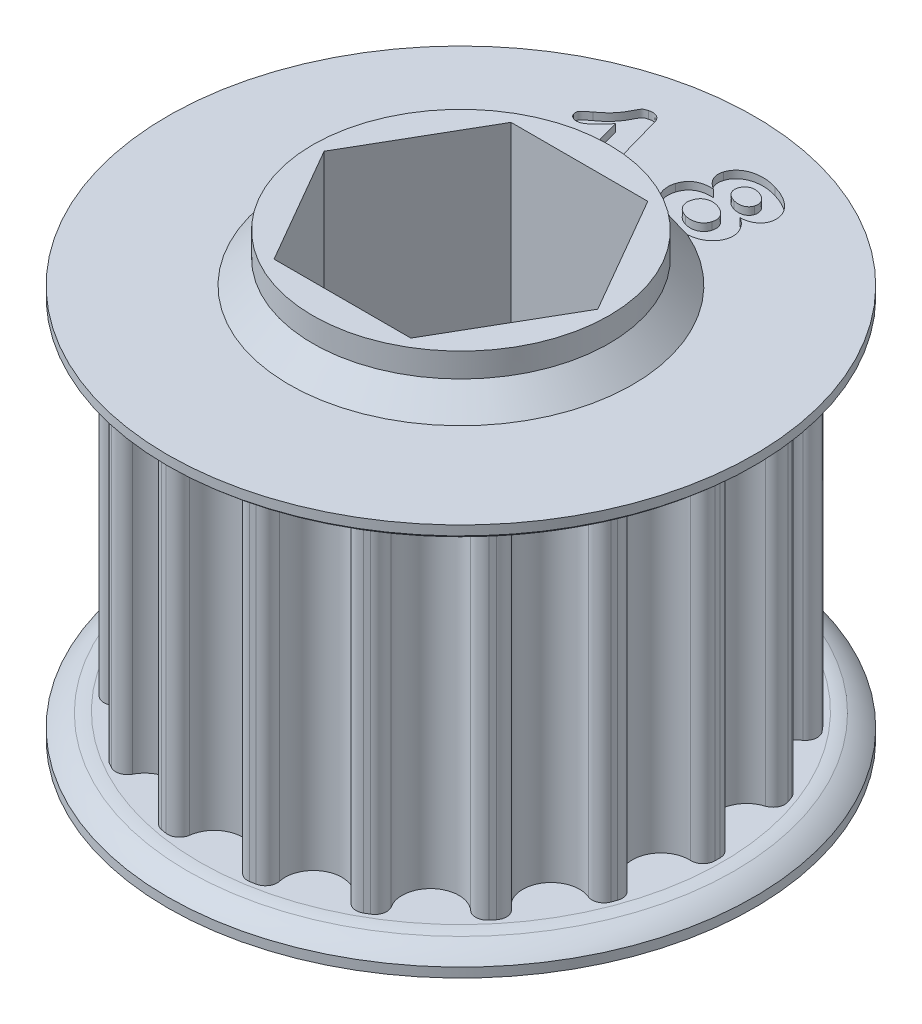
from build123d import *

# Parameters (mm, degrees)
SKETCH1_R               = 13.752444609
TOOTHOD_DEPTH           = 9.2456
TOOTHPROFILE_DEPTH      = 27.836243084
TOOTHPATTERN_COUNT      = 18
BORE_DEPTH              = 25.594187162
BORE_DEPTH_BACK         = 25.594187162
LARGE_TOOTH_COUNT_DEPTH = 0.4
SKETCH11_R              = 11.1125
CUT_EXTRUDE1_DEPTH      = 2.0574
SKETCH12_R              = 7.9375
BOSS_EXTRUDE1_DEPTH     = 2.5654
CHAMFER1_START          = 10.5156
CHAMFER1_2_DEPTH        = 1.4844


with BuildPart() as part:
    # Sketch1 → ToothOD (new, symmetric)
    with BuildSketch(Plane(origin=(0, 0, 0), x_dir=(1, 0, 0), z_dir=(0, 1, 0))):
        with Locations(Location((0, 0, 0), (0, 0, 270))):
            Circle(SKETCH1_R)
    extrude(amount=TOOTHOD_DEPTH, both=True)

    # Sketch2 → ToothProfile (cut, through all)
    with BuildSketch(Plane(origin=(0, 9.2456, 0), x_dir=(1, 0, 0), z_dir=(0, 1, 0))):
        with BuildLine():
            ThreePointArc((-1.512488775, 13.022501785), (0, 11.692444609), (1.512488775, 13.022501785))
            ThreePointArc((1.512488775, 13.022501785), (1.763425847, 13.450931805), (2.245984388, 13.567803317))
            ThreePointArc((2.245984388, 13.567803317), (0, 13.752444609), (-2.245984388, 13.567803317))
            ThreePointArc((-2.245984388, 13.567803317), (-1.763425847, 13.450931805), (-1.512488775, 13.022501785))
        make_face()
    toothprofile = extrude(amount=-TOOTHPROFILE_DEPTH, mode=Mode.SUBTRACT)

    # ToothPattern: ToothProfile ×18 about axis
    toothpattern_axis = Axis((0, 0, 0), (0, 1, 0))
    for i in range(1, TOOTHPATTERN_COUNT):
        add(toothprofile.rotate(toothpattern_axis, i * 360 / TOOTHPATTERN_COUNT), mode=Mode.SUBTRACT)

    # Sketch4 → Flange (revolve)
    with BuildSketch(Plane.XY, mode=Mode.PRIVATE) as flange_sk:
        with BuildLine():
            Line((0, -9.2456), (14.006444609, -9.2456))
            ThreePointArc((14.006444609, -9.2456), (14.332200599, -9.271222571), (14.652016937, -9.338237424))
            ThreePointArc((14.652016937, -9.338237424), (15.219745514, -9.619797125), (15.720944609, -10.0076))
            Line((15.720944609, -10.0076), (15.720944609, -10.5156))
            Line((15.720944609, -10.5156), (0, -10.5156))
            Line((0, -10.5156), (0, -9.2456))
        make_face()
        with BuildLine():
            Line((15.720944609, 10.5156), (15.720944609, 10.0076))
            ThreePointArc((15.720944609, 10.0076), (15.219745514, 9.619797125), (14.652016937, 9.338237424))
            ThreePointArc((14.652016937, 9.338237424), (14.332200599, 9.271222571), (14.006444609, 9.2456))
            Line((14.006444609, 9.2456), (0, 9.2456))
            Line((0, 9.2456), (0, 10.5156))
            Line((0, 10.5156), (15.720944609, 10.5156))
        make_face()
    revolve(flange_sk.sketch.rotate(Axis((0, 12.09802, 0), (0, -1, 0)), 90), axis=Axis((0, 12.09802, 0), (0, -1, 0)))

    # Sketch7 → Bore (cut, two sides: drawn at the far end of the back side and taken through both)
    with BuildSketch(Plane.XZ.offset(-BORE_DEPTH_BACK)):
        Polygon((3.666174209, -6.35), (7.332348419, 0), (3.666174209, 6.35), (-3.666174209, 6.35), (-7.332348419, 0), (-3.666174209, -6.35), align=None)
    extrude(amount=BORE_DEPTH + BORE_DEPTH_BACK, mode=Mode.SUBTRACT)

    # Sketch9 → Large Tooth Count (cut)
    # profile 1 of 2: a face of its own
    with BuildSketch(Plane(origin=(0, 10.5156, 0), x_dir=(1, 0, 0), z_dir=(0, 1, 0))):
        with BuildLine():
            Line((-2.662146112, 9.13643455), (-3.372949237, 11.650141581))
            add(Edge.make_bspline(
                [(-3.372949237, 11.650141581), (-3.425886305, 11.586746329), (-3.526926809, 11.465744383), (-3.67664036, 11.297436133), (-3.817791006, 11.151368133), (-3.949782561, 11.026746314), (-4.072552361, 10.923123379), (-4.1869291, 10.842020082), (-4.292131744, 10.781515123), (-4.362268826, 10.75688488), (-4.394505487, 10.745564238)],
                knots=[0, 0, 0, 0, 1.436647793, 2.742116684, 3.917528266, 4.968830495, 5.898952687, 6.709145598, 7.406692804, 8, 8, 8, 8], degree=3))
            add(Edge.make_bspline(
                [(-4.394505487, 10.745564238), (-4.423225201, 10.738815168), (-4.479844536, 10.725509748), (-4.567027042, 10.724682351), (-4.653271396, 10.736776751), (-4.735603427, 10.765339726), (-4.810361493, 10.805553804), (-4.872610741, 10.856712818), (-4.919809372, 10.919411507), (-4.93684367, 10.967618861), (-4.945467205, 10.992023613)],
                knots=[0, 0, 0, 0, 1.060506449, 2.090730045, 3.121009508, 4.186389385, 5.213927772, 6.165926039, 7.071508468, 8, 8, 8, 8], degree=3))
            add(Edge.make_bspline(
                [(-4.945467205, 10.992023613), (-4.952065941, 11.020431127), (-4.964499631, 11.073958086), (-4.95876176, 11.154221258), (-4.933697382, 11.226612115), (-4.883870287, 11.29032499), (-4.815598949, 11.352245055), (-4.731276461, 11.425268944), (-4.627016749, 11.507793149), (-4.54950049, 11.564404933), (-4.507912518, 11.594777519)],
                knots=[0, 0, 0, 0, 0.867897154, 1.635338254, 2.373085074, 3.124455607, 4.024800266, 5.129413542, 6.459911912, 8, 8, 8, 8], degree=3))
            add(Edge.make_bspline(
                [(-4.507912518, 11.594777519), (-4.44609749, 11.640572606), (-4.328078056, 11.728006203), (-4.167080305, 11.863045983), (-4.028489817, 11.99292925), (-3.912000809, 12.121676072), (-3.810672556, 12.249752549), (-3.718419857, 12.37979078), (-3.632959576, 12.513484127), (-3.570696337, 12.628710391), (-3.523124928, 12.71775882), (-3.491102822, 12.778706459), (-3.461657521, 12.833195777), (-3.434800545, 12.881377655), (-3.411198733, 12.923363496), (-3.389042374, 12.95817431), (-3.371822103, 12.987621058), (-3.350916395, 13.01936294), (-3.316732198, 13.053885704), (-3.260586928, 13.088060996), (-3.187083714, 13.118654111), (-3.131728276, 13.135673378), (-3.101486737, 13.144971269)],
                knots=[0, 0, 0, 0, 2.156763678, 4.117769312, 5.888962717, 7.478421277, 8.981374143, 10.465881738, 11.947829572, 13.427330936, 14.136785022, 14.77897899, 15.35784481, 15.873440825, 16.325849854, 16.708062088, 17.030133901, 17.282469466, 17.772361054, 18.376662839, 19.11314557, 20, 20, 20, 20], degree=3))
            add(Edge.make_bspline(
                [(-3.101486737, 13.144971269), (-3.059460626, 13.15491324), (-2.979408203, 13.173850962), (-2.860298498, 13.180591748), (-2.750571479, 13.162194548), (-2.65157859, 13.123624115), (-2.56509284, 13.067261641), (-2.494384027, 12.994951844), (-2.437531316, 12.909631659), (-2.416002124, 12.844415872), (-2.404971112, 12.811000956)],
                knots=[0, 0, 0, 0, 1.193490103, 2.273390807, 3.275207668, 4.247795912, 5.193374318, 6.107594792, 7.030379579, 8, 8, 8, 8], degree=3))
            Line((-2.404971112, 12.811000956), (-1.493250018, 9.582918925))
            add(Edge.make_bspline(
                [(-1.493250018, 9.582918925), (-1.486605218, 9.557707275), (-1.473647205, 9.508542073), (-1.46130282, 9.435343256), (-1.454795986, 9.365777239), (-1.454643505, 9.299694786), (-1.460757228, 9.237131037), (-1.473192451, 9.177772287), (-1.492077421, 9.122024156), (-1.517042142, 9.069486256), (-1.549717514, 9.021451015), (-1.5877077, 8.97596986), (-1.632174898, 8.934000332), (-1.683937705, 8.896987485), (-1.740170049, 8.861156874), (-1.804335751, 8.83170957), (-1.873830288, 8.803473188), (-1.923220153, 8.788662787), (-1.94866408, 8.781032988)],
                knots=[0, 0, 0, 0, 1.181889984, 2.304801904, 3.361933679, 4.347340366, 5.296963687, 6.207702345, 7.091327474, 7.960712225, 8.836778226, 9.718235453, 10.644546812, 11.600290629, 12.600472129, 13.663105359, 14.796113795, 16, 16, 16, 16], degree=3))
            add(Edge.make_bspline(
                [(-1.94866408, 8.781032988), (-1.989211377, 8.771066321), (-2.067454662, 8.751833847), (-2.184756361, 8.745559899), (-2.294958548, 8.758710424), (-2.396958286, 8.791433537), (-2.488622267, 8.845470542), (-2.563995893, 8.923269444), (-2.624470609, 9.021415317), (-2.649149437, 9.096757108), (-2.662146112, 9.13643455)],
                knots=[0, 0, 0, 0, 1.107720024, 2.137544594, 3.102013595, 4.042570764, 4.965058633, 5.899173896, 6.893636507, 8, 8, 8, 8], degree=3))
        make_face()
    # profile 2 of 2: a face of its own
    with BuildSketch(Plane(origin=(0, 10.5156, 0), x_dir=(1, 0, 0), z_dir=(0, 1, 0))):
        with BuildLine():
            add(Edge.make_bspline(
                [(1.763977795, 12.304863932), (1.772462452, 12.330925447), (1.789409695, 12.382980691), (1.822746894, 12.457928668), (1.861996616, 12.529759128), (1.908208107, 12.597569456), (1.958768894, 12.663566132), (2.017539963, 12.724633224), (2.080771418, 12.784058906), (2.150427719, 12.839206694), (2.22569855, 12.890125876), (2.30568538, 12.936665148), (2.391013515, 12.97679765), (2.480719945, 13.011333606), (2.574598516, 13.04245408), (2.674015418, 13.065601087), (2.777807679, 13.086042439), (2.886490092, 13.098685433), (2.998509103, 13.10701498), (3.113291996, 13.108640429), (3.230136487, 13.104183693), (3.349320245, 13.093224852), (3.471023459, 13.076557195), (3.594999628, 13.051642422), (3.721847829, 13.022871641), (3.806306036, 12.99852411), (3.849059827, 12.986199088)],
                knots=[0, 0, 0, 0, 0.809842585, 1.617578695, 2.421037097, 3.226468951, 4.041506402, 4.875701726, 5.728760898, 6.605590954, 7.498914008, 8.413610117, 9.338661129, 10.283221307, 11.254460088, 12.259746471, 13.298747387, 14.380436365, 15.492066129, 16.618608475, 17.772252836, 18.947412154, 20.155840334, 21.401908303, 22.684813797, 24, 24, 24, 24], degree=3))
            add(Edge.make_bspline(
                [(3.849059827, 12.986199088), (3.921744044, 12.963393107), (4.063013946, 12.919067133), (4.263615875, 12.837615732), (4.448791288, 12.750080082), (4.617334336, 12.653367133), (4.76893637, 12.549885927), (4.904788282, 12.441876541), (5.023311509, 12.328614307), (5.123331996, 12.210404574), (5.207100474, 12.090647296), (5.273414118, 11.969923529), (5.323714505, 11.849412293), (5.355584669, 11.729149315), (5.373336155, 11.610429497), (5.374356023, 11.493524455), (5.364108658, 11.377974964), (5.344103101, 11.303635405), (5.334066858, 11.266341275)],
                knots=[0, 0, 0, 0, 1.450841889, 2.819873404, 4.121144449, 5.350717867, 6.517866185, 7.615223588, 8.654029127, 9.635771325, 10.560789381, 11.433865107, 12.255316122, 13.042192494, 13.798494955, 14.535827359, 15.265464505, 16, 16, 16, 16], degree=3))
            add(Edge.make_bspline(
                [(5.334066858, 11.266341275), (5.326201711, 11.24264209), (5.310694583, 11.195916162), (5.279369686, 11.129357787), (5.244159994, 11.06525157), (5.200752722, 11.005754744), (5.152449253, 10.949254663), (5.098545619, 10.89616432), (5.038392116, 10.846981853), (4.972571667, 10.801770681), (4.902351186, 10.761047185), (4.828942803, 10.724755402), (4.751878536, 10.695703264), (4.671981479, 10.671299723), (4.588679913, 10.652696759), (4.501917399, 10.63911048), (4.411750034, 10.63212375), (4.350621136, 10.631670236), (4.319654358, 10.631440494)],
                knots=[0, 0, 0, 0, 0.931638965, 1.836843536, 2.742662106, 3.658788272, 4.581097284, 5.516442172, 6.47996071, 7.478923982, 8.495054935, 9.509177662, 10.53306083, 11.566851322, 12.626608633, 13.717616295, 14.843786302, 16, 16, 16, 16], degree=3))
            add(Edge.make_bspline(
                [(4.319654358, 10.631440494), (4.361307268, 10.607327044), (4.444162199, 10.55936117), (4.558151982, 10.471594464), (4.662158905, 10.372046293), (4.754808795, 10.261971912), (4.835689529, 10.146246348), (4.901665885, 10.027356768), (4.950049599, 9.906575805), (4.983939916, 9.785368394), (5.000677763, 9.663427342), (5.002752128, 9.541049264), (4.988521314, 9.418571782), (4.967707685, 9.338520706), (4.957234045, 9.29823815)],
                knots=[0, 0, 0, 0, 1.083019542, 2.154315536, 3.230612772, 4.31985941, 5.389139951, 6.406207581, 7.374704119, 8.313081631, 9.233642139, 10.138744009, 11.063396134, 12, 12, 12, 12], degree=3))
            add(Edge.make_bspline(
                [(4.957234045, 9.29823815), (4.947674325, 9.268560251), (4.92871191, 9.209691938), (4.890448615, 9.125339883), (4.846004466, 9.044946648), (4.794242084, 8.96871785), (4.73763191, 8.894758296), (4.671663536, 8.826503057), (4.600442935, 8.7610181), (4.522343457, 8.700368538), (4.43864025, 8.643791827), (4.347987216, 8.593898738), (4.251695944, 8.549878928), (4.149020754, 8.514108883), (4.041900259, 8.480948977), (3.92825936, 8.456680054), (3.809034602, 8.437722832), (3.684393539, 8.425699685), (3.555339168, 8.418765088), (3.422741585, 8.421804227), (3.287038426, 8.427793631), (3.148345683, 8.444146966), (3.006268368, 8.464618397), (2.861651006, 8.495513222), (2.713072127, 8.529024958), (2.614234053, 8.558294458), (2.564077795, 8.573147525)],
                knots=[0, 0, 0, 0, 0.806619525, 1.599989631, 2.393359737, 3.182000434, 3.983561344, 4.801185139, 5.63573712, 6.48663646, 7.358628842, 8.248550908, 9.162438473, 10.095996992, 11.061419444, 12.063570583, 13.101151084, 14.185356624, 15.304012189, 16.444588286, 17.617504992, 18.819080606, 20.058196613, 21.332188171, 22.646195229, 24, 24, 24, 24], degree=3))
            add(Edge.make_bspline(
                [(2.564077795, 8.573147525), (2.513976768, 8.588928347), (2.415652908, 8.619898398), (2.272336293, 8.67053232), (2.136630933, 8.726046176), (2.007660128, 8.78509497), (1.885386852, 8.847434304), (1.769670991, 8.913305486), (1.661969522, 8.984129873), (1.560547725, 9.057222684), (1.467176413, 9.133546561), (1.382078774, 9.212751463), (1.303819594, 9.292880016), (1.234198893, 9.376031679), (1.172223251, 9.461405414), (1.117414356, 9.548437429), (1.072068569, 9.638492656), (1.033177853, 9.729558234), (1.003095849, 9.822270329), (0.980441119, 9.915395631), (0.966428834, 10.008939556), (0.958605911, 10.102663897), (0.961001664, 10.196788578), (0.970023992, 10.290747037), (0.985476495, 10.385415073), (1.003139692, 10.447337191), (1.012098108, 10.478742838)],
                knots=[0, 0, 0, 0, 1.376526694, 2.701449926, 3.981976521, 5.217619407, 6.417713473, 7.577794816, 8.705021807, 9.794114075, 10.852836068, 11.862969898, 12.839410823, 13.786238464, 14.702130897, 15.602579528, 16.478224059, 17.341692661, 18.195202806, 19.029570204, 19.85037214, 20.671803966, 21.491010489, 22.313774607, 23.144780554, 24, 24, 24, 24], degree=3))
            add(Edge.make_bspline(
                [(1.012098108, 10.478742838), (1.022489656, 10.511418084), (1.042945662, 10.575740074), (1.083695201, 10.666471649), (1.129238187, 10.751224368), (1.180965517, 10.829207504), (1.239543931, 10.900183035), (1.303751181, 10.964591049), (1.374523034, 11.022337834), (1.450663231, 11.074151633), (1.533929475, 11.117933871), (1.622650887, 11.155546141), (1.717680474, 11.186667035), (1.818793017, 11.211789223), (1.926295132, 11.229522339), (2.039993197, 11.239772765), (2.159538658, 11.24444972), (2.241120558, 11.24239017), (2.282792639, 11.24133815)],
                knots=[0, 0, 0, 0, 1.017533359, 2.003038312, 2.948397344, 3.872691892, 4.777030521, 5.677125236, 6.569022037, 7.485974566, 8.407390212, 9.358024634, 10.344797424, 11.373899457, 12.449303277, 13.57695381, 14.762306631, 16, 16, 16, 16], degree=3))
            add(Edge.make_bspline(
                [(2.282792639, 11.24133815), (2.254274958, 11.260045555), (2.198919131, 11.296358599), (2.121575845, 11.35540382), (2.050379159, 11.414369472), (1.986360376, 11.475406995), (1.930181732, 11.538227404), (1.879911957, 11.601423332), (1.836442892, 11.666002447), (1.801066438, 11.732423119), (1.770807428, 11.799166743), (1.749696582, 11.868010708), (1.733987105, 11.937826467), (1.726550615, 12.009086791), (1.724021452, 12.081750089), (1.731078191, 12.155210386), (1.743148857, 12.23033384), (1.756937838, 12.279673561), (1.763977795, 12.304863932)],
                knots=[0, 0, 0, 0, 1.274930318, 2.474774172, 3.636214709, 4.730432849, 5.778623564, 6.785091583, 7.748223775, 8.684484688, 9.596482191, 10.483552873, 11.372088692, 12.268121665, 13.158815903, 14.085902129, 15.02275827, 16, 16, 16, 16], degree=3))
        make_face()
        with BuildLine():
            add(Edge.make_bspline(
                [(3.765120764, 9.687572525), (3.773524693, 9.719532551), (3.78999335, 9.782162628), (3.797931704, 9.877753636), (3.791038231, 9.971015501), (3.768020698, 10.060918977), (3.732102503, 10.147352136), (3.682450847, 10.229219188), (3.619122936, 10.305717577), (3.542823817, 10.375674528), (3.456251094, 10.440094267), (3.359480351, 10.49629786), (3.25326934, 10.543769564), (3.178380481, 10.568681223), (3.140042639, 10.581434244)],
                knots=[0, 0, 0, 0, 0.970304789, 1.901446026, 2.805705687, 3.70792968, 4.618226953, 5.548915551, 6.512724104, 7.528432887, 8.585791224, 9.680178579, 10.812414185, 12, 12, 12, 12], degree=3))
            add(Edge.make_bspline(
                [(3.140042639, 10.581434244), (3.09092203, 10.594017005), (2.995769295, 10.618391378), (2.850797443, 10.628269433), (2.71113197, 10.614265573), (2.599906196, 10.58195036), (2.516345937, 10.54472983), (2.458996499, 10.508199256), (2.405321441, 10.466361037), (2.358347345, 10.415772933), (2.315626593, 10.358702426), (2.278619052, 10.294406461), (2.245906021, 10.22336671), (2.229579119, 10.172653783), (2.221177795, 10.146558463)],
                knots=[0, 0, 0, 0, 1.588024391, 3.076200886, 4.531169983, 5.970232692, 6.6889002, 7.393602153, 8.097932852, 8.817873035, 9.551785792, 10.330091813, 11.140716344, 12, 12, 12, 12], degree=3))
            add(Edge.make_bspline(
                [(2.221177795, 10.146558463), (2.211734457, 10.111949786), (2.19338643, 10.044706523), (2.184917495, 9.942731706), (2.190664018, 9.845088621), (2.212481193, 9.752322449), (2.247755792, 9.665985126), (2.292751134, 9.58536144), (2.348438683, 9.511518257), (2.415218514, 9.445697436), (2.490149842, 9.385994473), (2.574895145, 9.337089622), (2.665697052, 9.292664744), (2.730750329, 9.27155587), (2.764102795, 9.260733463)],
                knots=[0, 0, 0, 0, 1.10409687, 2.145215691, 3.138473457, 4.109085983, 5.068570516, 6.005447555, 6.94890931, 7.909358987, 8.88977135, 9.89395062, 10.920239789, 12, 12, 12, 12], degree=3))
            add(Edge.make_bspline(
                [(2.764102795, 9.260733463), (2.802018995, 9.250350093), (2.87622771, 9.230027999), (2.988341317, 9.214665402), (3.09731007, 9.209097426), (3.202514153, 9.218526967), (3.302809386, 9.238552504), (3.396154575, 9.27085605), (3.482313393, 9.314056988), (3.559856224, 9.368552315), (3.628953626, 9.433240929), (3.685847588, 9.509190592), (3.733740243, 9.59382234), (3.754515905, 9.65589021), (3.765120764, 9.687572525)],
                knots=[0, 0, 0, 0, 1.160276165, 2.270865915, 3.335849153, 4.377261886, 5.382744493, 6.350565096, 7.286579906, 8.220982215, 9.141627236, 10.070301291, 11.014992418, 12, 12, 12, 12], degree=3))
        make_face(mode=Mode.SUBTRACT)
        with BuildLine():
            add(Edge.make_bspline(
                [(3.664215295, 12.294148307), (3.620744937, 12.305828513), (3.537143332, 12.328291729), (3.410984396, 12.33578684), (3.291993823, 12.324040875), (3.181618346, 12.290114668), (3.082309017, 12.23580977), (3.000282233, 12.158325349), (2.934995387, 12.061276915), (2.908336345, 11.986534977), (2.894476233, 11.947676432)],
                knots=[0, 0, 0, 0, 1.134002296, 2.180897853, 3.171085351, 4.138651513, 5.077445379, 6.002723738, 6.961610424, 8, 8, 8, 8], degree=3))
            add(Edge.make_bspline(
                [(2.894476233, 11.947676432), (2.885154582, 11.910424401), (2.86719261, 11.838643134), (2.871601015, 11.728363748), (2.900834447, 11.624005925), (2.955615001, 11.527253041), (3.031134718, 11.440713339), (3.12523656, 11.366624129), (3.235965903, 11.305338617), (3.318110725, 11.277283095), (3.36060592, 11.2627694)],
                knots=[0, 0, 0, 0, 0.987530998, 1.902882238, 2.813150942, 3.762945732, 4.749398901, 5.761519987, 6.841988553, 8, 8, 8, 8], degree=3))
            add(Edge.make_bspline(
                [(3.36060592, 11.2627694), (3.410017179, 11.249889121), (3.505142914, 11.22509222), (3.647034893, 11.21450076), (3.776822896, 11.225407158), (3.892926357, 11.256320289), (3.99318197, 11.30761114), (4.07592025, 11.378173692), (4.142900301, 11.464495336), (4.167772918, 11.532753136), (4.180351233, 11.567271744)],
                knots=[0, 0, 0, 0, 1.253672931, 2.413550281, 3.479195088, 4.443480961, 5.350353082, 6.222928646, 7.101318385, 8, 8, 8, 8], degree=3))
            add(Edge.make_bspline(
                [(4.180351233, 11.567271744), (4.186405353, 11.591543937), (4.19838861, 11.639587237), (4.204025939, 11.713240634), (4.196157237, 11.786061337), (4.178352491, 11.857683252), (4.149458671, 11.927754281), (4.109849847, 11.995115525), (4.059196471, 12.058922662), (3.998076993, 12.118547815), (3.928229645, 12.173886286), (3.848084196, 12.221397466), (3.759897352, 12.262664833), (3.696611586, 12.283488547), (3.664215295, 12.294148307)],
                knots=[0, 0, 0, 0, 0.905153687, 1.791620998, 2.658463209, 3.547549336, 4.456547669, 5.394064334, 6.369023387, 7.39827146, 8.481019306, 9.588605023, 10.765595223, 12, 12, 12, 12], degree=3))
        make_face(mode=Mode.SUBTRACT)
    extrude(amount=-LARGE_TOOTH_COUNT_DEPTH, mode=Mode.SUBTRACT)

    # Sketch11 → Cut-Extrude1 (cut)
    with BuildSketch(Plane.XZ.offset(10.5156)):
        with Locations(Location((0, 0, 0), (0, 0, 270))):
            Circle(SKETCH11_R)
    extrude(amount=-CUT_EXTRUDE1_DEPTH, mode=Mode.SUBTRACT)

    # Sketch12 → Boss-Extrude1 (add)
    with BuildSketch(Plane(origin=(0, 10.5156, 0), x_dir=(1, 0, 0), z_dir=(0, 1, 0))):
        with Locations(Location((0, 0, 0), (0, 0, 90))):
            Circle(SKETCH12_R)
        Polygon((-3.666174209, 6.35), (-7.332348419, 0), (-3.666174209, -6.35), (3.666174209, -6.35), (7.332348419, 0), (3.666174209, 6.35), align=None, mode=Mode.SUBTRACT)
    extrude(amount=BOSS_EXTRUDE1_DEPTH)

    # Chamfer1: read off the stored shape, not the designer's step
    # Chamfer1 outline → Chamfer1 (revolve)
    with BuildSketch(Plane.XY):
        Polygon((9.2075, 10.5156), (7.9375, 11.7856), (7.9375, 10.5156), align=None)
    revolve(axis=Axis((0, 0, 0), (0, 1, 0)))

    # Chamfer1 2 outline → Chamfer1 2 (cut)
    with BuildSketch(Plane(origin=(0, 0, 0), x_dir=(1, 0, 0), z_dir=(0, 1, 0)).offset(CHAMFER1_START)):
        with BuildLine():
            ThreePointArc((3.706825261, 8.428374857), (2.641088468, 8.820584332), (1.535176079, 9.078617222))
            add(Edge.make_bspline(
                [(2.564077795, 8.573147525), (2.513976768, 8.588928347), (2.415652908, 8.619898398), (2.272336293, 8.67053232), (2.136630933, 8.726046176), (2.007660128, 8.78509497), (1.885386852, 8.847434304), (1.769670991, 8.913305486), (1.661969522, 8.984129873), (1.584682419, 9.039829257), (1.543524963, 9.071984685), (1.535176079, 9.078617222)],
                knots=[0, 0, 0, 0, 0.057355279, 0.112560414, 0.165915688, 0.217400809, 0.267404728, 0.315741451, 0.362709242, 0.408088086, 0.419728981, 0.419728981, 0.419728981, 0.419728981], degree=3))
            add(Edge.make_bspline(
                [(3.706825261, 8.428374857), (3.699768051, 8.427790443), (3.649618308, 8.423831076), (3.555339168, 8.418765088), (3.422741585, 8.421804227), (3.287038426, 8.427793631), (3.148345683, 8.444146966), (3.006268368, 8.464618397), (2.861651006, 8.495513222), (2.713072127, 8.529024958), (2.614234053, 8.558294458), (2.564077795, 8.573147525)],
                knots=[0.583419995, 0.583419995, 0.583419995, 0.583419995, 0.591056526, 0.637667175, 0.685191179, 0.734062708, 0.784128359, 0.835758192, 0.888841174, 0.943591468, 1, 1, 1, 1], degree=3))
        make_face()
        with BuildLine():
            add(Edge.make_bspline(
                [(-1.94866408, 8.781032988), (-1.989211377, 8.771066321), (-2.067454662, 8.751833847), (-2.184756361, 8.745559899), (-2.294958548, 8.758710424), (-2.396958286, 8.791433537), (-2.463725237, 8.830793448), (-2.495565671, 8.85714729), (-2.500523972, 8.8614579)],
                knots=[0, 0, 0, 0, 0.138465003, 0.267193074, 0.387751699, 0.505321345, 0.620632329, 0.642428978, 0.642428978, 0.642428978, 0.642428978], degree=3))
            add(Edge.make_bspline(
                [(-1.511542839, 9.082581929), (-1.513706942, 9.078466141), (-1.525234244, 9.057443254), (-1.549717514, 9.021451015), (-1.5877077, 8.97596986), (-1.632174898, 8.934000332), (-1.683937705, 8.896987485), (-1.740170049, 8.861156874), (-1.804335751, 8.83170957), (-1.873830288, 8.803473188), (-1.923220153, 8.788662787), (-1.94866408, 8.781032988)],
                knots=[0.484370271, 0.484370271, 0.484370271, 0.484370271, 0.497544514, 0.552298639, 0.607389716, 0.665284176, 0.725018164, 0.787529508, 0.853944085, 0.924757112, 1, 1, 1, 1], degree=3))
            ThreePointArc((-1.511542839, 9.082581929), (-2.009077894, 8.985636442), (-2.500523972, 8.8614579))
        make_face()
    extrude(amount=CHAMFER1_2_DEPTH, mode=Mode.SUBTRACT)


solid = part.part
